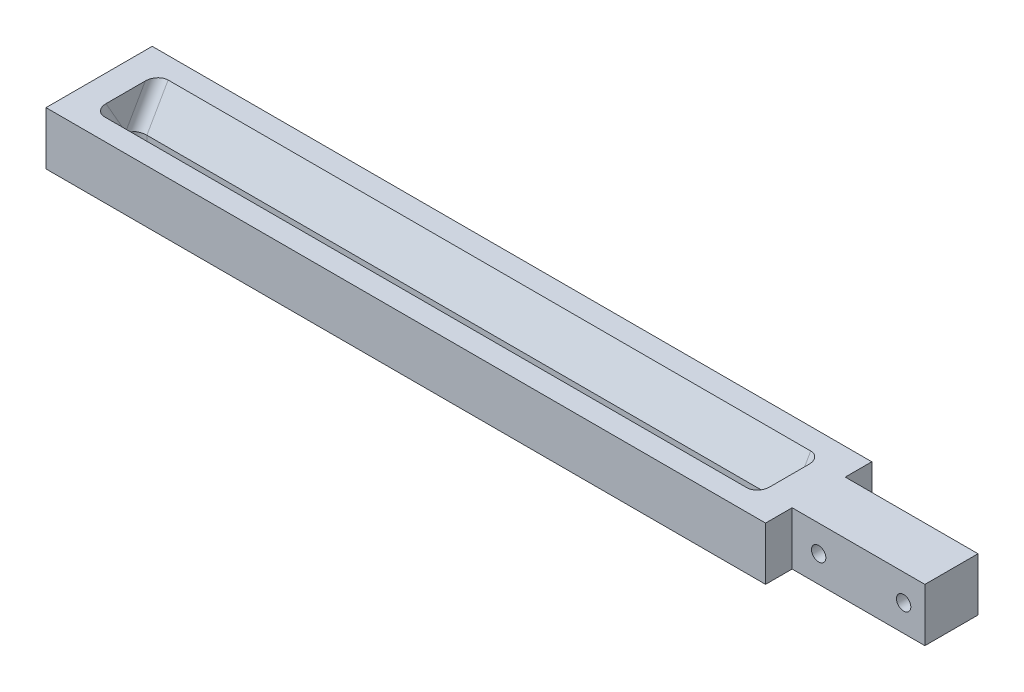
from build123d import *

# Parameters (mm, degrees)
SKETCH_1_W          = 135
SKETCH_1_H          = 20
EXTRUDE_3_DEPTH     = 10
CUT_EXTRUDE_1_DEPTH = 62.5
FILLET_1_R          = 2
SKETCH_4_W          = 25.5
SKETCH_4_H          = 20
EXTRUDE_5_DEPTH     = 10
SKETCH_5_R          = 1.35
CUT_EXTRUDE_2_DEPTH = 96.650405122
SKETCH_6_W          = 25
SKETCH_6_H          = 5
CUT_EXTRUDE_3_DEPTH = 95.069123521


with BuildPart() as part:
    # 草图1 → 凸台-拉伸3 (new body)
    with BuildSketch(Plane(origin=(0, 0, 0), x_dir=(1, 0, 0), z_dir=(0, 1, 0))):
        Rectangle(SKETCH_1_W, SKETCH_1_H)
    extrude(amount=EXTRUDE_3_DEPTH)

    # 草图2 → 切除-拉伸1 (cut, symmetric)
    with BuildSketch(Plane(origin=(0, 0, 0), x_dir=(0, 0, -1), z_dir=(1, 0, 0))):
        Polygon((-6, 10), (-2, 3), (-2, 0), (2, 0), (2, 3), (6, 10), align=None)
    extrude(amount=CUT_EXTRUDE_1_DEPTH, both=True, mode=Mode.SUBTRACT)

    # 圆角1
    fillet_1_edges = [part.edges().sort_by_distance(p)[0] for p in [
        (62.5, 6.5, 4),
        (62.5, 6.5, -4),
        (-62.5, 6.5, -4),
        (-62.5, 6.5, 4),
        (-62.5, 1.5, -2),
        (62.5, 1.5, -2),
        (62.5, 1.5, 2),
        (-62.5, 1.5, 2),
    ]]
    fillet(fillet_1_edges, radius=FILLET_1_R - 0.0001)  # a hair under: the kernel refuses the full size

    # 草图4 → 凸台-拉伸5 (add)
    with BuildSketch(Plane(origin=(0, 10, 0), x_dir=(1, 0, 0), z_dir=(0, 1, 0))):
        with Locations((80.25, 0)):
            Rectangle(SKETCH_4_W, SKETCH_4_H)
    extrude(amount=-EXTRUDE_5_DEPTH)

    # 草图5 → 切除-拉伸2 (cut, through all)
    with BuildSketch(Plane(origin=(0, 0, -10), x_dir=(-1, 0, 0), z_dir=(0, 0, -1))):
        with Locations((-89, 5)):
            Circle(SKETCH_5_R)
        with Locations((-73, 5)):
            Circle(SKETCH_5_R)
    extrude(amount=-CUT_EXTRUDE_2_DEPTH, mode=Mode.SUBTRACT)

    # 草图6 → 切除-拉伸3 (cut, through all)
    with BuildSketch(Plane(origin=(0, 10, 0), x_dir=(1, 0, 0), z_dir=(0, 1, 0))):
        with Locations((80.5, -7.5)):
            Rectangle(SKETCH_6_W, SKETCH_6_H)
        with Locations((80.5, 7.5)):
            Rectangle(SKETCH_6_W, SKETCH_6_H)
    extrude(amount=-CUT_EXTRUDE_3_DEPTH, mode=Mode.SUBTRACT)


solid = part.part
